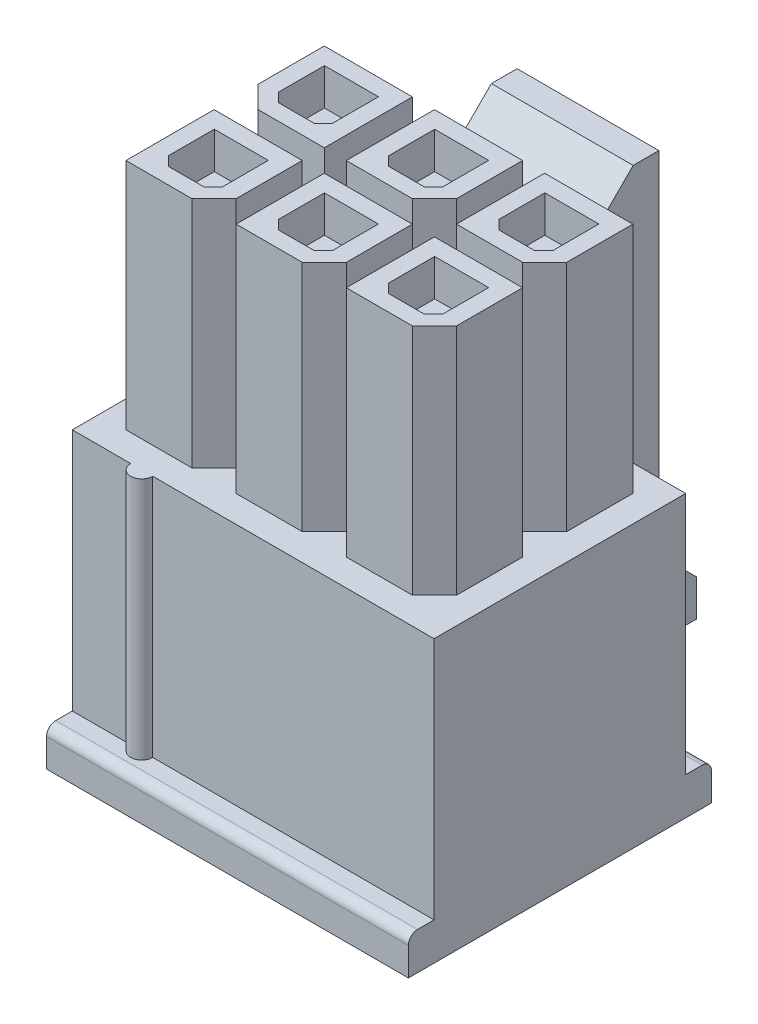
from build123d import *

# Parameters (mm, degrees)
BOSS_EXTRUDE1_START  = -0.825
BOSS_EXTRUDE1_DEPTH  = 1.65
BOSS_EXTRUDE2_START  = 1.105
BOSS_EXTRUDE2_DEPTH  = 1.105
BOSS_EXTRUDE3_DEPTH  = 1.105
CUT_EXTRUDE1_DEPTH   = 1.65
SKETCH5_W            = 9.85
SKETCH5_H            = 7.65
BOSS_EXTRUDE4_DEPTH  = 7.55
CUT_EXTRUDE2_REACH   = 15.28
SKETCH6_W            = 1.65
SKETCH6_H            = 5.3
SKETCH7_W            = 3.86
SKETCH7_H            = 2.52
BOSS_EXTRUDE5_DEPTH  = 4
SKETCH8_W            = 1.65
SKETCH8_H            = 9.3
CUT_EXTRUDE3_DEPTH   = 0.9
SKETCH9_W            = 0.7
SKETCH9_H            = 6.63
CUT_EXTRUDE4_DEPTH   = 15.996819663
BOSS_EXTRUDE6_DEPTH  = 6.63
CUT_EXTRUDE5_DEPTH   = 14.226552839
SKETCH12_W           = 2.4
SKETCH12_H           = 2.4
BOSS_EXTRUDE7_DEPTH  = 6.35
SKETCH13_W           = 1.47
SKETCH13_H           = 1.5
CUT_EXTRUDE6_DEPTH   = 1
SKETCH14_W           = 2.4
SKETCH14_H           = 2.4
BOSS_EXTRUDE8_DEPTH  = 6.35
SKETCH15_W           = 1.47
SKETCH15_H           = 1.5
CUT_EXTRUDE7_DEPTH   = 1
SKETCH16_W           = 2.4
SKETCH16_H           = 2.4
BOSS_EXTRUDE9_DEPTH  = 6.35
SKETCH17_W           = 1.47
SKETCH17_H           = 1.5
CUT_EXTRUDE8_DEPTH   = 1
SKETCH18_W           = 2.4
SKETCH18_H           = 2.4
BOSS_EXTRUDE10_DEPTH = 6.35
SKETCH19_W           = 1.47
SKETCH19_H           = 1.5
CUT_EXTRUDE9_DEPTH   = 1
SKETCH20_W           = 2.4
SKETCH20_H           = 2.4
BOSS_EXTRUDE11_DEPTH = 6.35
SKETCH21_W           = 1.47
SKETCH21_H           = 1.5
CUT_EXTRUDE10_DEPTH  = 1
SKETCH22_W           = 2.4
SKETCH22_H           = 2.4
BOSS_EXTRUDE12_DEPTH = 6.35
SKETCH23_W           = 1.47
SKETCH23_H           = 1.5
CUT_EXTRUDE11_DEPTH  = 1
SKETCH24_W           = 2.49
SKETCH24_H           = 2.49
CUT_EXTRUDE12_DEPTH  = 1
SKETCH25_W           = 2.49
SKETCH25_H           = 2.49
CUT_EXTRUDE13_DEPTH  = 1
SKETCH26_W           = 2.49
SKETCH26_H           = 2.49
CUT_EXTRUDE14_DEPTH  = 1
SKETCH27_W           = 2.49
SKETCH27_H           = 2.49
CUT_EXTRUDE15_DEPTH  = 1
SKETCH28_W           = 2.49
SKETCH28_H           = 2.49
CUT_EXTRUDE16_DEPTH  = 1
SKETCH29_W           = 2.29
SKETCH29_H           = 1.02
BOSS_EXTRUDE13_DEPTH = 0.7
SKETCH30_W           = 2.3
SKETCH30_H           = 1.02
BOSS_EXTRUDE14_DEPTH = 0.7
SKETCH31_W           = 2.49
SKETCH31_H           = 2.49
CUT_EXTRUDE17_DEPTH  = 1
CHAMFER1_SIZE        = 0.6
CHAMFER2_SIZE        = 0.25
FILLET1_R            = 0.25
FILLET2_R            = 0.15


with BuildPart() as part:
    # Boss-Extrude1: read off the stored shape, not the designer's step
    # Boss-Extrude1 outline → Boss-Extrude1 (new body)
    with BuildSketch(Plane.YZ.offset(BOSS_EXTRUDE1_START)):
        with BuildLine():
            Line((2.98, -3.42), (1.55, -3.42))
            Line((1.55, -3.42), (1.55, -6.7))
            Line((1.55, -6.7), (9.11, -6.7))
            Line((9.11, -6.7), (9.11, -4.98))
            Line((9.11, -4.98), (8.11, -3.98))
            Line((8.11, -3.98), (2.98, -3.98))
            ThreePointArc((2.98, -3.98), (2.7, -3.7), (2.98, -3.42))
        make_face()
    extrude(amount=BOSS_EXTRUDE1_DEPTH)

    # Sketch2 → Boss-Extrude2 (add)
    with BuildSketch(Plane.ZY.offset(0.825).offset(BOSS_EXTRUDE2_START)):
        with BuildLine():
            Line((-6.7, 1.55), (-6.7, 9.11))
            Line((-6.7, 9.11), (-4.98, 9.11))
            Line((-4.98, 9.11), (-3.98, 8.11))
            Line((-3.98, 8.11), (-3.98, 2.98))
            ThreePointArc((-3.98, 2.98), (-3.7, 2.7), (-3.42, 2.98))
            Line((-3.42, 2.98), (-3.42, 1.55))
            Line((-3.42, 1.55), (-6.7, 1.55))
        make_face()
    extrude(amount=-BOSS_EXTRUDE2_DEPTH)

    # Sketch3 → Boss-Extrude3 (add)
    with BuildSketch(Plane(origin=(0.825, 0, 0), x_dir=(0, 0, -1), z_dir=(1, 0, 0))):
        with BuildLine():
            Line((6.7, 1.55), (3.42, 1.55))
            Line((3.42, 1.55), (3.42, 2.98))
            ThreePointArc((3.42, 2.98), (3.7, 2.7), (3.98, 2.98))
            Line((3.98, 2.98), (3.98, 8.11))
            Line((3.98, 8.11), (4.98, 9.11))
            Line((4.98, 9.11), (6.7, 9.11))
            Line((6.7, 9.11), (6.7, 1.55))
        make_face()
    extrude(amount=BOSS_EXTRUDE3_DEPTH)

    # Sketch4 → Cut-Extrude1 (cut)
    with BuildSketch(Plane(origin=(-0.825, 0, 0), x_dir=(0, -1, 0), z_dir=(-1, 0, 0))):
        with BuildLine():
            Line((-2.98, -3.98), (-1.55, -3.98))
            Line((-1.55, -3.98), (-1.55, -3.42))
            Line((-1.55, -3.42), (-2.98, -3.42))
            ThreePointArc((-2.98, -3.42), (-2.7, -3.7), (-2.98, -3.98))
        make_face()
    extrude(amount=-CUT_EXTRUDE1_DEPTH, mode=Mode.SUBTRACT)

    # Sketch5 → Boss-Extrude4 (add)
    with BuildSketch(Plane(origin=(0, 0, -3.42), x_dir=(-1, 0, 0), z_dir=(0, 0, -1))):
        with Locations((0.005, -0.175)):
            Rectangle(SKETCH5_W, SKETCH5_H)
    extrude(amount=-BOSS_EXTRUDE4_DEPTH)

    # Sketch6 → Cut-Extrude2 (cut, up to next)
    with BuildSketch(Plane(origin=(0, 0, -4.18), x_dir=(-1, 0, 0), z_dir=(0, 0, -1)), mode=Mode.PRIVATE) as cut_extrude2_sk1:
        with Locations((0, 4.2)):
            Rectangle(SKETCH6_W, SKETCH6_H)
    cut_extrude2_tool1 = extrude(cut_extrude2_sk1.sketch, amount=-CUT_EXTRUDE2_REACH, mode=Mode.PRIVATE) & part.part
    add(cut_extrude2_tool1.solids().sort_by_distance((0, 4.2, -4.18))[0], mode=Mode.SUBTRACT)

    # Sketch7 → Boss-Extrude5 (add)
    with BuildSketch(Plane.XZ.offset(-1.55)):
        with Locations((0, -5.44)):
            Rectangle(SKETCH7_W, SKETCH7_H)
    extrude(amount=BOSS_EXTRUDE5_DEPTH)

    # Sketch8 → Cut-Extrude3 (cut)
    with BuildSketch(Plane.XY.offset(-4.18)):
        with Locations((0, 2.2)):
            Rectangle(SKETCH8_W, SKETCH8_H)
    extrude(amount=-CUT_EXTRUDE3_DEPTH, mode=Mode.SUBTRACT)

    # Sketch9 → Cut-Extrude4 (cut, through all)
    with BuildSketch(Plane.ZY.offset(4.93)):
        with Locations((3.78, 0.335)):
            Rectangle(SKETCH9_W, SKETCH9_H)
    extrude(amount=-CUT_EXTRUDE4_DEPTH, mode=Mode.SUBTRACT)

    # Sketch10 → Boss-Extrude6 (add)
    with BuildSketch(Plane(origin=(0, -2.98, 0), x_dir=(-1, 0, 0), z_dir=(0, 1, 0))):
        with BuildLine():
            Line((3.34, 3.43), (2.74, 3.43))
            ThreePointArc((2.74, 3.43), (3.04, 3.73), (3.34, 3.43))
        make_face()
    extrude(amount=BOSS_EXTRUDE6_DEPTH)

    # Sketch11 → Cut-Extrude5 (cut, through all)
    with BuildSketch(Plane(origin=(1.93, 0, 0), x_dir=(0, 0, -1), z_dir=(1, 0, 0))):
        Polygon((5.68, -0.43), (6.7, -1.45), (6.7, 9.11), (5.68, 9.11), align=None)
    extrude(amount=-CUT_EXTRUDE5_DEPTH, mode=Mode.SUBTRACT)

    # Sketch12 → Boss-Extrude7 (add)
    with BuildSketch(Plane(origin=(0, 3.65, 0), x_dir=(-1, 0, 0), z_dir=(0, 1, 0))):
        with Locations((3, 1.5)):
            Rectangle(SKETCH12_W, SKETCH12_H)
    extrude(amount=BOSS_EXTRUDE7_DEPTH)

    # Sketch13 → Cut-Extrude6 (cut)
    with BuildSketch(Plane(origin=(0, 10, 0), x_dir=(-1, 0, 0), z_dir=(0, 1, 0))):
        with Locations((3, 1.51)):
            Rectangle(SKETCH13_W, SKETCH13_H)
    extrude(amount=-CUT_EXTRUDE6_DEPTH, mode=Mode.SUBTRACT)

    # Sketch14 → Boss-Extrude8 (add)
    with BuildSketch(Plane(origin=(0, 3.65, 0), x_dir=(-1, 0, 0), z_dir=(0, 1, 0))):
        with Locations((0, 1.5)):
            Rectangle(SKETCH14_W, SKETCH14_H)
    extrude(amount=BOSS_EXTRUDE8_DEPTH)

    # Sketch15 → Cut-Extrude7 (cut)
    with BuildSketch(Plane(origin=(0, 10, 0), x_dir=(-1, 0, 0), z_dir=(0, 1, 0))):
        with Locations((0, 1.51)):
            Rectangle(SKETCH15_W, SKETCH15_H)
    extrude(amount=-CUT_EXTRUDE7_DEPTH, mode=Mode.SUBTRACT)

    # Sketch16 → Boss-Extrude9 (add)
    with BuildSketch(Plane(origin=(0, 3.65, 0), x_dir=(-1, 0, 0), z_dir=(0, 1, 0))):
        with Locations((0, -1.5)):
            Rectangle(SKETCH16_W, SKETCH16_H)
    extrude(amount=BOSS_EXTRUDE9_DEPTH)

    # Sketch17 → Cut-Extrude8 (cut)
    with BuildSketch(Plane(origin=(0, 10, 0), x_dir=(-1, 0, 0), z_dir=(0, 1, 0))):
        with Locations((0, -1.49)):
            Rectangle(SKETCH17_W, SKETCH17_H)
    extrude(amount=-CUT_EXTRUDE8_DEPTH, mode=Mode.SUBTRACT)

    # Sketch18 → Boss-Extrude10 (add)
    with BuildSketch(Plane(origin=(0, 3.65, 0), x_dir=(-1, 0, 0), z_dir=(0, 1, 0))):
        with Locations((-3, 1.5)):
            Rectangle(SKETCH18_W, SKETCH18_H)
    extrude(amount=BOSS_EXTRUDE10_DEPTH)

    # Sketch19 → Cut-Extrude9 (cut)
    with BuildSketch(Plane(origin=(0, 10, 0), x_dir=(-1, 0, 0), z_dir=(0, 1, 0))):
        with Locations((-3, 1.51)):
            Rectangle(SKETCH19_W, SKETCH19_H)
    extrude(amount=-CUT_EXTRUDE9_DEPTH, mode=Mode.SUBTRACT)

    # Sketch20 → Boss-Extrude11 (add)
    with BuildSketch(Plane(origin=(0, 3.65, 0), x_dir=(-1, 0, 0), z_dir=(0, 1, 0))):
        with Locations((-3, -1.5)):
            Rectangle(SKETCH20_W, SKETCH20_H)
    extrude(amount=BOSS_EXTRUDE11_DEPTH)

    # Sketch21 → Cut-Extrude10 (cut)
    with BuildSketch(Plane(origin=(0, 10, 0), x_dir=(-1, 0, 0), z_dir=(0, 1, 0))):
        with Locations((-3, -1.49)):
            Rectangle(SKETCH21_W, SKETCH21_H)
    extrude(amount=-CUT_EXTRUDE10_DEPTH, mode=Mode.SUBTRACT)

    # Sketch22 → Boss-Extrude12 (add)
    with BuildSketch(Plane(origin=(0, 3.65, 0), x_dir=(-1, 0, 0), z_dir=(0, 1, 0))):
        with Locations((3, -1.5)):
            Rectangle(SKETCH22_W, SKETCH22_H)
    extrude(amount=BOSS_EXTRUDE12_DEPTH)

    # Sketch23 → Cut-Extrude11 (cut)
    with BuildSketch(Plane(origin=(0, 10, 0), x_dir=(-1, 0, 0), z_dir=(0, 1, 0))):
        with Locations((3, -1.49)):
            Rectangle(SKETCH23_W, SKETCH23_H)
    extrude(amount=-CUT_EXTRUDE11_DEPTH, mode=Mode.SUBTRACT)

    # Sketch24 → Cut-Extrude12 (cut)
    with BuildSketch(Plane.XZ.offset(4)):
        with Locations((-3, -1.375)):
            Rectangle(SKETCH24_W, SKETCH24_H)
    extrude(amount=-CUT_EXTRUDE12_DEPTH, mode=Mode.SUBTRACT)

    # Sketch25 → Cut-Extrude13 (cut)
    with BuildSketch(Plane.XZ.offset(4)):
        with Locations((-3, 1.625)):
            Rectangle(SKETCH25_W, SKETCH25_H)
    extrude(amount=-CUT_EXTRUDE13_DEPTH, mode=Mode.SUBTRACT)

    # Sketch26 → Cut-Extrude14 (cut)
    with BuildSketch(Plane.XZ.offset(4)):
        with Locations((0, -1.375)):
            Rectangle(SKETCH26_W, SKETCH26_H)
    extrude(amount=-CUT_EXTRUDE14_DEPTH, mode=Mode.SUBTRACT)

    # Sketch27 → Cut-Extrude15 (cut)
    with BuildSketch(Plane.XZ.offset(4)):
        with Locations((0, 1.625)):
            Rectangle(SKETCH27_W, SKETCH27_H)
    extrude(amount=-CUT_EXTRUDE15_DEPTH, mode=Mode.SUBTRACT)

    # Sketch28 → Cut-Extrude16 (cut)
    with BuildSketch(Plane.XZ.offset(4)):
        with Locations((3, -1.375)):
            Rectangle(SKETCH28_W, SKETCH28_H)
    extrude(amount=-CUT_EXTRUDE16_DEPTH, mode=Mode.SUBTRACT)

    # Sketch29 → Boss-Extrude13 (add)
    with BuildSketch(Plane(origin=(0, 0, -3.42), x_dir=(-1, 0, 0), z_dir=(0, 0, -1))):
        with Locations((-3.775, -3.49)):
            Rectangle(SKETCH29_W, SKETCH29_H)
    extrude(amount=BOSS_EXTRUDE13_DEPTH)

    # Sketch30 → Boss-Extrude14 (add)
    with BuildSketch(Plane(origin=(0, 0, -3.42), x_dir=(-1, 0, 0), z_dir=(0, 0, -1))):
        with Locations((3.78, -3.49)):
            Rectangle(SKETCH30_W, SKETCH30_H)
    extrude(amount=BOSS_EXTRUDE14_DEPTH)

    # Sketch31 → Cut-Extrude17 (cut)
    with BuildSketch(Plane.XZ.offset(4)):
        with Locations((3, 1.625)):
            Rectangle(SKETCH31_W, SKETCH31_H)
    extrude(amount=-CUT_EXTRUDE17_DEPTH, mode=Mode.SUBTRACT)

    # Chamfer1
    chamfer1_edges = [part.edges().sort_by_distance(p)[0] for p in [
        (-1.8, 6.825, 2.7),
        (1.2, 6.825, 2.7),
        (1.2, 6.825, -0.3),
        (4.2, 6.825, 2.7),
        (4.2, 6.825, -0.3),
        (-4.2, 6.825, -0.3),
    ]]
    chamfer(chamfer1_edges, length=CHAMFER1_SIZE)

    # Chamfer2
    chamfer2_edges = [part.edges().sort_by_distance(p)[0] for p in [
        (-2.265, 9.5, 2.26),
        (-3.735, 9.5, 2.26),
        (0.735, 9.5, 2.26),
        (-0.735, 9.5, 2.26),
        (0.735, 9.5, -0.74),
        (-0.735, 9.5, -0.74),
        (3.735, 9.5, 2.26),
        (2.265, 9.5, 2.26),
        (3.735, 9.5, -0.74),
        (2.265, 9.5, -0.74),
        (-2.265, 9.5, -0.74),
        (-3.735, 9.5, -0.74),
    ]]
    chamfer(chamfer2_edges, length=CHAMFER2_SIZE)

    # Fillet1
    fillet1_edges = [part.edges().sort_by_distance(p)[0] for p in [
        (-1.93, 2.265, -3.42),
        (1.93, 2.265, -3.42),
        (-0.005, -2.98, 4.13),
        (3.775, -2.98, -4.12),
        (-3.78, -2.98, -4.12),
    ]]
    fillet(fillet1_edges, radius=FILLET1_R - 0.0001)  # a hair under: the kernel refuses the full size

    # Fillet2
    fillet2_edges = [part.edges().sort_by_distance(p)[0] for p in [
        (1.3775, 1.55, -4.18),
        (-1.3775, 1.55, -4.18),
    ]]
    fillet(fillet2_edges, radius=FILLET2_R)


solid = part.part
